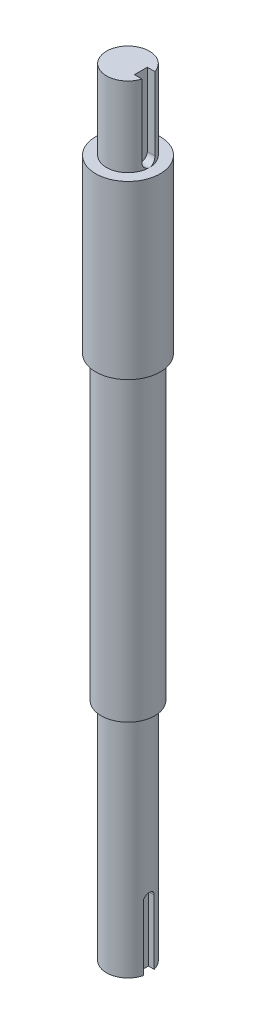
from build123d import *

# Parameters (mm, degrees)
CUT_EXTRUDE1_START = 6
CUT_EXTRUDE1_DEPTH = 331.66897689
CUT_EXTRUDE2_START = 10
CUT_EXTRUDE2_DEPTH = 3
SKETCH4_R          = 4
CUT_EXTRUDE3_DEPTH = 30


with BuildPart() as part:
    # Sketch1 → Revolve1 (revolve)
    with BuildSketch(Plane(origin=(0, 0, 0), x_dir=(0, 0, -1), z_dir=(1, 0, 0))):
        Polygon((0, 26), (10, 26), (10, -11), (15, -11), (15, -91), (12.5, -91), (12.5, -231), (10, -231), (10, -242.2), (10, -336), (0, -336), align=None)
    revolve(axis=Axis((0, 26, 0), (0, -1, 0)))

    # Sketch2 → Cut-Extrude1 (cut, through all)
    with BuildSketch(Plane(origin=(0, 0, 0), x_dir=(0, 0, -1), z_dir=(1, 0, 0)).offset(CUT_EXTRUDE1_START)):
        with BuildLine():
            Line((3, 26), (3, -8))
            ThreePointArc((3, -8), (0, -11), (-3, -8))
            Line((-3, -8), (-3, 26))
            ThreePointArc((-3, 26), (0, 29), (3, 26))
        make_face()
    extrude(amount=CUT_EXTRUDE1_DEPTH, mode=Mode.SUBTRACT)

    # Sketch3 → Cut-Extrude2 (cut)
    with BuildSketch(Plane(origin=(0, 0, 0), x_dir=(0, 0, -1), z_dir=(1, 0, 0)).offset(CUT_EXTRUDE2_START)):
        with BuildLine():
            Line((2.5, -306), (2.5, -336))
            ThreePointArc((2.5, -336), (0, -338.5), (-2.5, -336))
            Line((-2.5, -336), (-2.5, -306))
            ThreePointArc((-2.5, -306), (0, -303.5), (2.5, -306))
        make_face()
    extrude(amount=-CUT_EXTRUDE2_DEPTH, mode=Mode.SUBTRACT)

    # Sketch4 → Cut-Extrude3 (cut)
    with BuildSketch(Plane.XZ.offset(336)):
        Circle(SKETCH4_R)
    extrude(amount=-CUT_EXTRUDE3_DEPTH, mode=Mode.SUBTRACT)


solid = part.part
